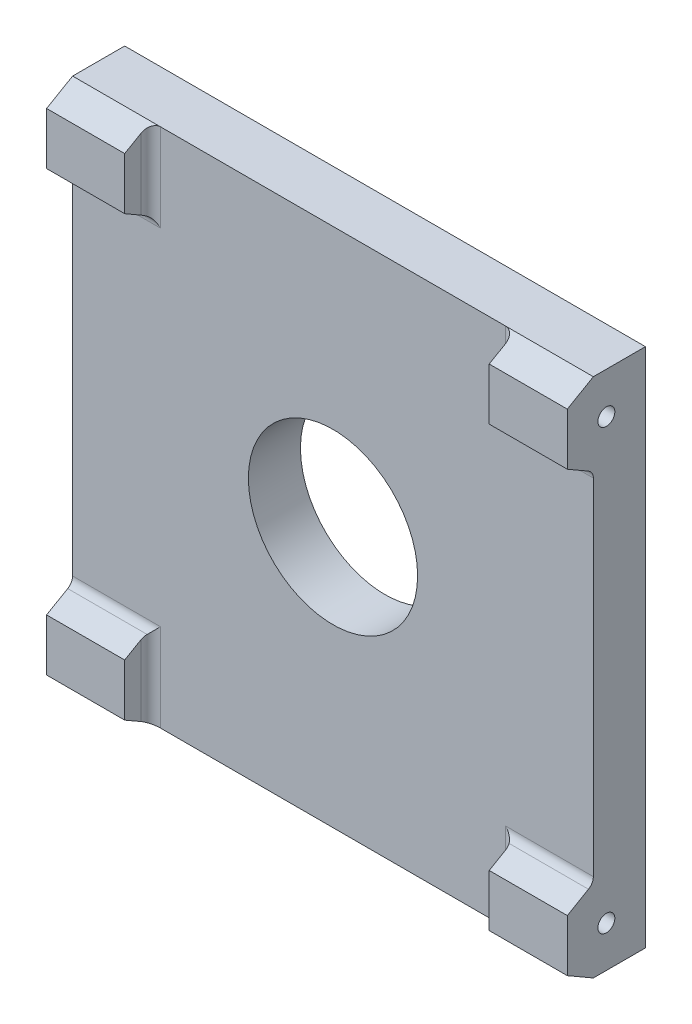
from build123d import *

# Parameters (mm, degrees)
SKETCH_1_W             = 80
SKETCH_1_H             = 80
EXTRUDE_1_DEPTH        = 8
SKETCH_6_R             = 13
CUT_EXTRUDE_3_DEPTH    = 50
EXTRUDE_2_DEPTH        = 12
FILLET_1_R             = 1.5
FILLET_1_OF_MIRROR_1_R = 1.5
SKETCH_8_R             = 1.3
CUT_EXTRUDE_4_DEPTH    = 10


with BuildPart() as part:
    # 草图1 → 凸台-拉伸1 (new body)
    with BuildSketch(Plane.XY):
        Rectangle(SKETCH_1_W, SKETCH_1_H)
    extrude(amount=EXTRUDE_1_DEPTH)

    # 草图6 → 切除-拉伸3 (cut)
    with BuildSketch(Plane.XY.offset(8)):
        Circle(SKETCH_6_R)
    extrude(amount=-CUT_EXTRUDE_3_DEPTH, mode=Mode.SUBTRACT)

    # 草图7 → 凸台-拉伸2 (add)
    with BuildSketch(Plane.ZY.offset(40)):
        Polygon((8, 40), (8, 27.381197846), (12, 29.690598923), (12, 37.690598923), align=None)
        Polygon((12, -37.690598923), (8, -40), (8, -27.381197846), (12, -29.690598923), align=None)
    extrude_2 = extrude(amount=-EXTRUDE_2_DEPTH)

    # 圆角1
    fillet_1_edges = [part.edges().sort_by_distance(p)[0] for p in [
        (-34, 27.381197846, 8),
        (-28, 33.690598923, 8),
        (-28, -33.690598923, 8),
        (-34, -27.381197846, 8),
    ]]
    fillet(fillet_1_edges, radius=FILLET_1_R)

    # 镜向1: 凸台-拉伸2 across plane
    add(extrude_2.mirror(Plane(origin=(0, 0, 0), x_dir=(0, 0, 1), z_dir=(1, 0, 0))))

    # 圆角1 of 镜向1
    fillet_1_of_mirror_1_edges = [part.edges().sort_by_distance(p)[0] for p in [
        (34, 27.381197846, 8),
        (28, 33.690598923, 8),
        (28, -33.690598923, 8),
        (34, -27.381197846, 8),
    ]]
    fillet(fillet_1_of_mirror_1_edges, radius=FILLET_1_OF_MIRROR_1_R)

    # 草图8 → 切除-拉伸4 (cut)
    with BuildSketch(Plane.ZY.offset(40)):
        with Locations((6, 33.690598923)):
            Circle(SKETCH_8_R)
        with Locations((6, -33.690598923)):
            Circle(SKETCH_8_R)
    cut_extrude_4 = extrude(amount=-CUT_EXTRUDE_4_DEPTH, mode=Mode.SUBTRACT)

    # 镜向2: 切除-拉伸4 across plane
    add(cut_extrude_4.mirror(Plane(origin=(0, 0, 0), x_dir=(0, 0, 1), z_dir=(1, 0, 0))), mode=Mode.SUBTRACT)


solid = part.part
